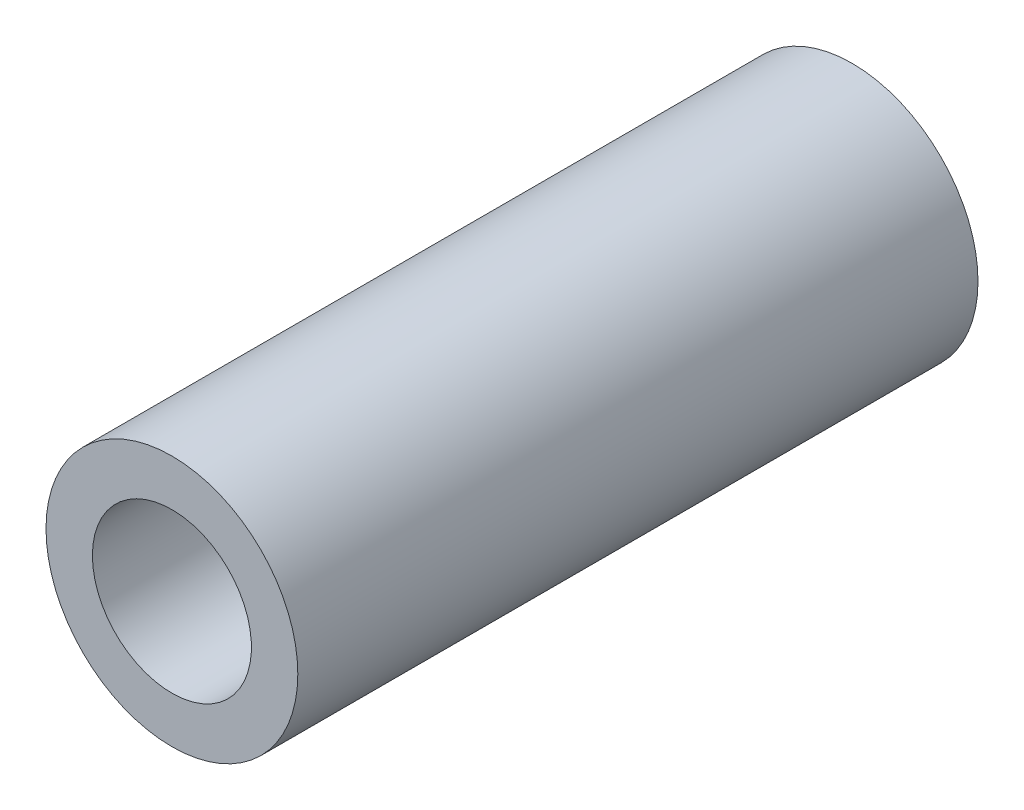
from build123d import *

# Parameters (mm, degrees)
SKETCH1_R      = 2.375
SKETCH1_R_2    = 1.5
EXTRUDE1_DEPTH = 6.415


with BuildPart() as part:
    # Sketch1 → Extrude1 (new, symmetric)
    with BuildSketch(Plane.XY):
        Circle(SKETCH1_R)
        Circle(SKETCH1_R_2, mode=Mode.SUBTRACT)
    extrude(amount=EXTRUDE1_DEPTH, both=True)


solid = part.part
